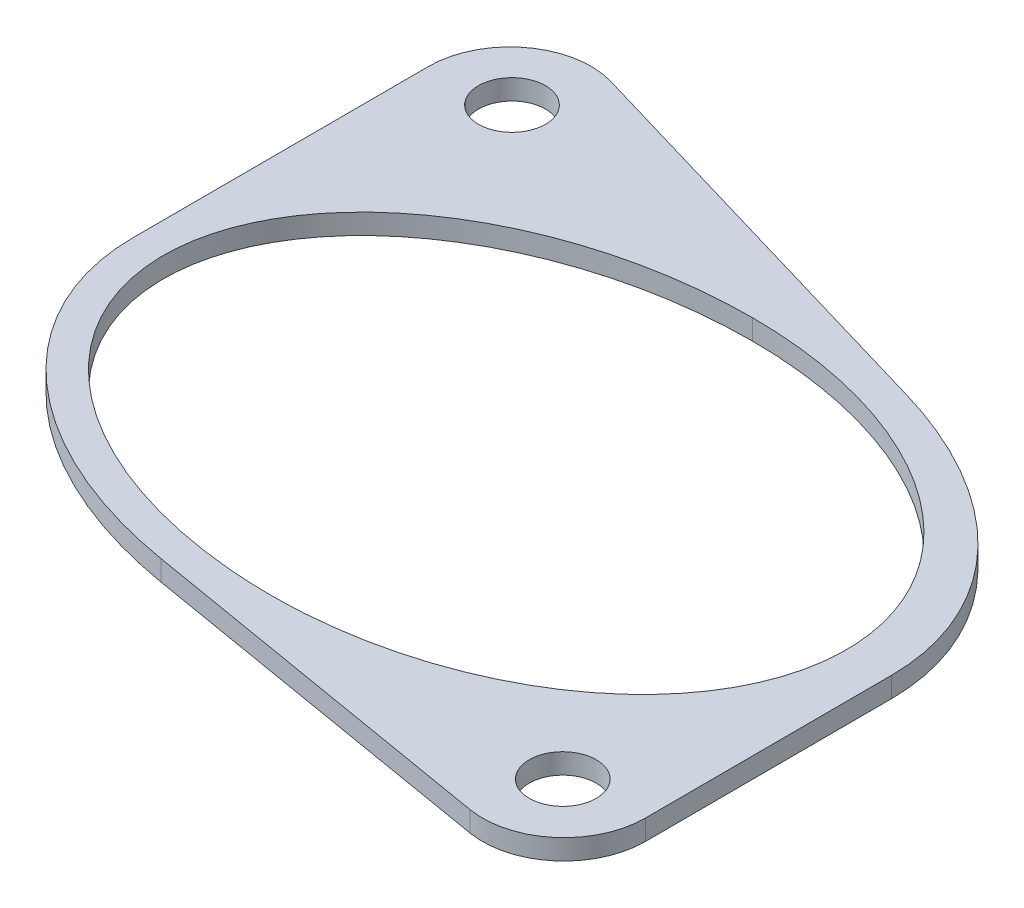
from build123d import *

# Parameters (mm, degrees)
SKETCH1_R           = 1.65
BOSS_EXTRUDE1_DEPTH = 1
FILLET1_R           = 4


with BuildPart() as part:
    # Sketch1 → Boss-Extrude1 (new body)
    with BuildSketch(Plane(origin=(0, 0, 0), x_dir=(1, 0, 0), z_dir=(0, 1, 0))):
        with BuildLine():
            Line((7.111633917, 12.343558773), (-18.709903661, 19.950061023))
            Line((-18.709903661, 19.950061023), (-18.670019077, -3.8e-08))
            Line((-18.670019077, -3.8e-08), (-18.669980923, -0.019084404))
            add(Edge.make_bspline(
                [(-18.669980923, -0.019084404), (-18.648894527, -10.566389726), (-4.293858101, -12.992135772)],
                knots=[3.143134422, 3.143134422, 3.143134422, 4.480324611, 4.480324611, 4.480324611], degree=2, weights=[0.99950355, 0.784463738, 1]))
            Line((-4.293858101, -12.992135772), (18.710515471, -16.879466085))
            Line((18.710515471, -16.879466085), (18.669972539, 0.022897354))
            add(Edge.make_bspline(
                [(18.669972539, 0.022897354), (18.648571471, 8.945010518), (7.111633917, 12.343558773)],
                knots=[0.001715158, 0.001715158, 0.001715158, 1.164506421, 1.164506421, 1.164506421], degree=2, weights=[1, 0.783396252, 0.887827452]))
        make_face()
        with BuildLine():
            add(Edge.make_bspline(
                [(0, 11.85), (-17.17, 11.85), (-17.17, 0), (-17.17, -11.85), (0, -11.85)],
                knots=[4.71238898, 4.71238898, 4.71238898, 6.283185307, 6.283185307, 7.853981634, 7.853981634, 7.853981634], degree=2, weights=[1, 0.707106781, 1, 0.707106781, 1]))
            add(Edge.make_bspline(
                [(0, -11.85), (16.47, -11.85), (16.47, 0), (16.47, 11.85), (0, 11.85)],
                knots=[4.71238898, 4.71238898, 4.71238898, 6.283185307, 6.283185307, 7.853981634, 7.853981634, 7.853981634], degree=2, weights=[1, 0.707106781, 1, 0.707106781, 1]))
        make_face(mode=Mode.SUBTRACT)
        with Locations((15, -12.5)):
            Circle(SKETCH1_R, mode=Mode.SUBTRACT)
        with Locations((-15, 15)):
            Circle(SKETCH1_R, mode=Mode.SUBTRACT)
    extrude(amount=BOSS_EXTRUDE1_DEPTH)

    # Fillet1
    fillet1_edges = [part.edges().sort_by_distance(p)[0] for p in [
        (18.710515471, 0.5, 16.879466085),
        (-18.709903661, 0.5, -19.950061023),
    ]]
    fillet(fillet1_edges, radius=FILLET1_R)


solid = part.part
